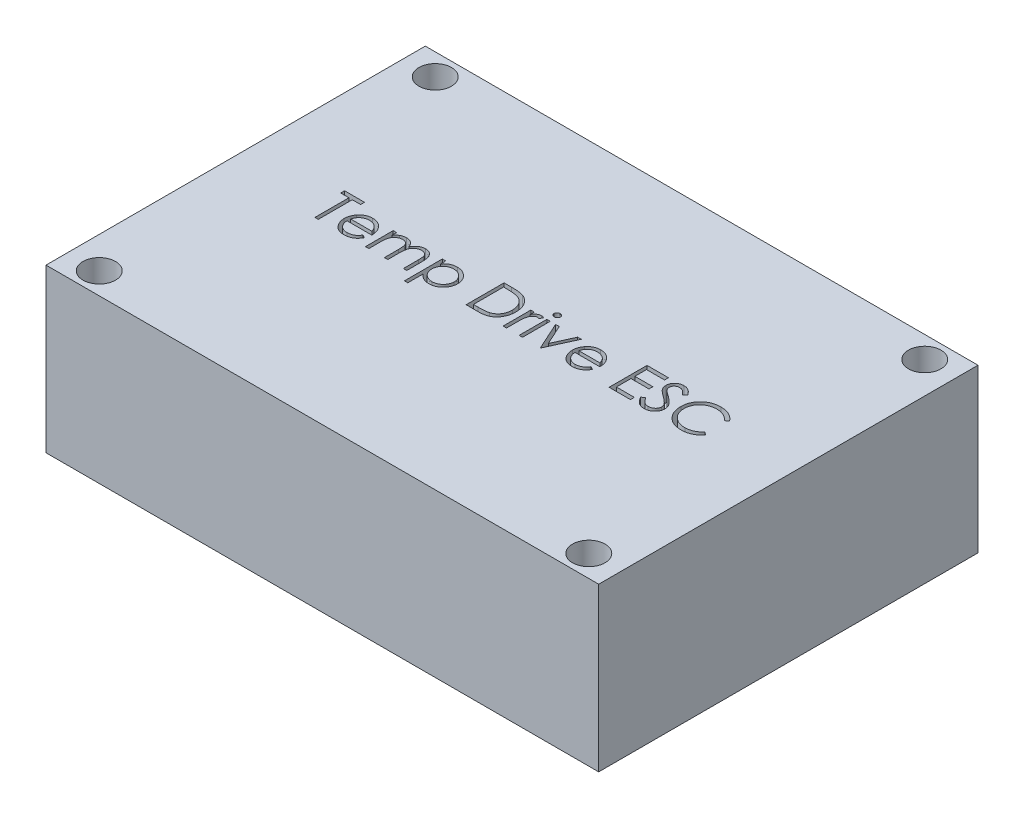
from build123d import *

# Parameters (mm, degrees)
SKETCH1_W           = 51
SKETCH1_H           = 35
SKETCH1_R           = 1.5
BOSS_EXTRUDE1_DEPTH = 15
SKETCH2_W           = 0.314102564
SKETCH2_H           = 2.557692308
CUT_EXTRUDE1_DEPTH  = 1.4


with BuildPart() as part:
    # Sketch1 → Boss-Extrude1 (new body)
    with BuildSketch(Plane(origin=(0, 0, 0), x_dir=(1, 0, 0), z_dir=(0, 1, 0))):
        Rectangle(SKETCH1_W, SKETCH1_H)
        with Locations((-22.585714286, 15.5)):
            Circle(SKETCH1_R, mode=Mode.SUBTRACT)
        with Locations((22.585714286, 15.5)):
            Circle(SKETCH1_R, mode=Mode.SUBTRACT)
        with Locations((22.585714286, -15.5)):
            Circle(SKETCH1_R, mode=Mode.SUBTRACT)
        with Locations((-22.585714286, -15.5)):
            Circle(SKETCH1_R, mode=Mode.SUBTRACT)
    extrude(amount=BOSS_EXTRUDE1_DEPTH)

    # Sketch2 → Cut-Extrude1 (cut)
    # profile 1 of 13: a face of its own
    with BuildSketch(Plane(origin=(0, 15, 0), x_dir=(1, 0, 0), z_dir=(0, 1, 0))):
        Polygon((-17.667113502, 1.856715019), (-17.667113502, 2.215689378), (-15.827369912, 2.215689378), (-15.827369912, 1.856715019), (-16.590190425, 1.856715019), (-16.590190425, -1.284310622), (-16.904292989, -1.284310622), (-16.904292989, 1.856715019), align=None)
    # profile 2 of 13: a face of its own
    with BuildSketch(Plane(origin=(0, 15, 0), x_dir=(1, 0, 0), z_dir=(0, 1, 0))):
        with BuildLine():
            Line((-13.279493309, -0.476618314), (-13.000446835, -0.62315277))
            add(Edge.make_bspline(
                [(-13.000446835, -0.62315277), (-13.02268343, -0.662596101), (-13.065947039, -0.739337204), (-13.140347787, -0.844769064), (-13.218339859, -0.93961678), (-13.303443827, -1.021346434), (-13.393113506, -1.092597819), (-13.487846161, -1.154935644), (-13.588134979, -1.208054164), (-13.693984703, -1.252806692), (-13.806284255, -1.287216186), (-13.925305771, -1.311520407), (-14.051277266, -1.326543676), (-14.137623446, -1.328288817), (-14.181837059, -1.329182417)],
                knots=[0, 0, 0, 0, 1.120438281, 2.179929193, 3.190490725, 4.156257408, 5.095198341, 6.022838206, 6.959905092, 7.901321166, 8.864066838, 9.862729781, 10.905609505, 12, 12, 12, 12], degree=3))
            add(Edge.make_bspline(
                [(-14.181837059, -1.329182417), (-14.230979037, -1.328035242), (-14.326840799, -1.325797435), (-14.466380546, -1.306504971), (-14.597759964, -1.275032612), (-14.720971667, -1.23106707), (-14.83571392, -1.173639746), (-14.942214775, -1.103680264), (-15.041034301, -1.02154801), (-15.12905851, -0.926531566), (-15.208302393, -0.824849609), (-15.278228213, -0.718893724), (-15.336685644, -0.6089305), (-15.384238254, -0.495659976), (-15.422643119, -0.379796082), (-15.449409823, -0.260284615), (-15.464839571, -0.137449031), (-15.467204016, -0.054351695), (-15.468395553, -0.012475686)],
                knots=[0, 0, 0, 0, 1.145258523, 2.234067595, 3.276747158, 4.290159414, 5.277019952, 6.260822364, 7.254936242, 8.264827045, 9.274100331, 10.257902744, 11.220704747, 12.172965371, 13.118907548, 14.062713208, 15.023725156, 16, 16, 16, 16], degree=3))
            add(Edge.make_bspline(
                [(-15.468395553, -0.012475686), (-15.467336412, 0.026819144), (-15.465237333, 0.104696309), (-15.452006546, 0.219961853), (-15.428558253, 0.331990306), (-15.396381929, 0.440874754), (-15.354830683, 0.546432888), (-15.303998464, 0.648728951), (-15.243806086, 0.747654091), (-15.197333412, 0.810057225), (-15.173924399, 0.84149066)],
                knots=[0, 0, 0, 0, 1.024358464, 2.0301432, 3.019427413, 4.004406732, 4.986367066, 5.972626655, 6.978780325, 8, 8, 8, 8], degree=3))
            add(Edge.make_bspline(
                [(-15.173924399, 0.84149066), (-15.142216716, 0.87935953), (-15.07980577, 0.95389768), (-14.974249414, 1.051836006), (-14.859949218, 1.133879781), (-14.738337592, 1.201886918), (-14.608001118, 1.253560565), (-14.470691827, 1.292068147), (-14.324846241, 1.313646158), (-14.22514102, 1.316693991), (-14.17412472, 1.31825348)],
                knots=[0, 0, 0, 0, 1.030682036, 2.02871468, 2.997146059, 3.962720338, 4.930598197, 5.918074684, 6.934738563, 8, 8, 8, 8], degree=3))
            add(Edge.make_bspline(
                [(-14.17412472, 1.31825348), (-14.121677114, 1.316899432), (-14.018786868, 1.314243096), (-13.868754747, 1.289616763), (-13.726794031, 1.250564208), (-13.592961527, 1.195410418), (-13.467243666, 1.124250866), (-13.350457616, 1.036109025), (-13.240606104, 0.933690937), (-13.176697525, 0.854927728), (-13.144176803, 0.814848032)],
                knots=[0, 0, 0, 0, 1.056321875, 2.072262726, 3.055038591, 4.01806755, 4.982017516, 5.957941055, 6.960871419, 8, 8, 8, 8], degree=3))
            add(Edge.make_bspline(
                [(-13.144176803, 0.814848032), (-13.122049865, 0.78464445), (-13.077943272, 0.724438332), (-13.022696172, 0.626267175), (-12.974738777, 0.52355658), (-12.936405816, 0.414646283), (-12.905366314, 0.300826703), (-12.882909496, 0.181284158), (-12.869739877, 0.056054247), (-12.86715118, -0.029272309), (-12.86583145, -0.072772161)],
                knots=[0, 0, 0, 0, 0.94817472, 1.890038105, 2.849395472, 3.817997239, 4.812318967, 5.836947057, 6.897266129, 8, 8, 8, 8], degree=3))
            Line((-12.86583145, -0.072772161), (-15.154292989, -0.072772161))
            add(Edge.make_bspline(
                [(-15.154292989, -0.072772161), (-15.152753382, -0.106472625), (-15.149725808, -0.172743229), (-15.135610665, -0.269714012), (-15.113361892, -0.362087354), (-15.082092829, -0.449170396), (-15.044225984, -0.532100523), (-14.997840267, -0.61026256), (-14.942500713, -0.68330049), (-14.880775014, -0.751867628), (-14.812067918, -0.812928389), (-14.739785171, -0.867580165), (-14.662891606, -0.913385762), (-14.581993522, -0.950565652), (-14.497221737, -0.979671968), (-14.408549542, -0.999539789), (-14.316151426, -1.012846895), (-14.253165692, -1.014326561), (-14.22109988, -1.015079853)],
                knots=[0, 0, 0, 0, 1.094153842, 2.151609401, 3.174256925, 4.172055639, 5.149267565, 6.128595816, 7.11444997, 8.118368179, 9.117203808, 10.09244225, 11.054858984, 12.015122123, 12.976791628, 13.957293641, 14.960065497, 16, 16, 16, 16], degree=3))
            add(Edge.make_bspline(
                [(-14.22109988, -1.015079853), (-14.189748732, -1.014471796), (-14.127542041, -1.013265295), (-14.034901184, -1.001533384), (-13.943761657, -0.982563109), (-13.854500673, -0.956673119), (-13.768929827, -0.925096266), (-13.689684277, -0.886993409), (-13.616804062, -0.844843662), (-13.548687095, -0.796633987), (-13.482616102, -0.7376258), (-13.417073615, -0.663990079), (-13.346796962, -0.576902551), (-13.302807369, -0.511356885), (-13.279493309, -0.476618314)],
                knots=[0, 0, 0, 0, 0.99110716, 1.966546729, 2.947904876, 3.932708344, 4.903319531, 5.828989031, 6.710028674, 7.56322171, 8.463672341, 9.504779593, 10.677557249, 12, 12, 12, 12], degree=3))
        make_face()
        with BuildLine():
            add(Edge.make_bspline(
                [(-13.179934015, 0.241330403), (-13.191430639, 0.282993277), (-13.213557941, 0.363180898), (-13.259794305, 0.474221788), (-13.311865846, 0.572909689), (-13.373487577, 0.658489322), (-13.443306303, 0.734492835), (-13.523951485, 0.80091142), (-13.614387379, 0.860328872), (-13.71414652, 0.910481371), (-13.819788305, 0.95317123), (-13.930394497, 0.981796345), (-14.043252284, 1.001405888), (-14.119586571, 1.003231996), (-14.157998918, 1.004150916)],
                knots=[0, 0, 0, 0, 1.154881502, 2.222775134, 3.210006277, 4.132804581, 5.035138423, 5.962687519, 6.919655026, 7.923214229, 8.944639381, 9.960483929, 10.97369054, 12, 12, 12, 12], degree=3))
            add(Edge.make_bspline(
                [(-14.157998918, 1.004150916), (-14.189348357, 1.003539245), (-14.251319606, 1.002330099), (-14.342620674, 0.990859969), (-14.430300373, 0.971900125), (-14.515005661, 0.945935168), (-14.595626529, 0.911326565), (-14.673821297, 0.870743339), (-14.747601693, 0.821201755), (-14.793742989, 0.7834429), (-14.817053406, 0.764367262)],
                knots=[0, 0, 0, 0, 1.04873581, 2.073130211, 3.073294108, 4.04793562, 5.032784715, 6.005352987, 6.992311501, 8, 8, 8, 8], degree=3))
            add(Edge.make_bspline(
                [(-14.817053406, 0.764367262), (-14.833746687, 0.749272947), (-14.867529822, 0.718725731), (-14.912670343, 0.666096524), (-14.955890816, 0.609344962), (-14.995224469, 0.546299837), (-15.031302055, 0.477679058), (-15.065062032, 0.404061423), (-15.095448444, 0.324888293), (-15.112544554, 0.269715854), (-15.121340265, 0.241330403)],
                knots=[0, 0, 0, 0, 0.879870761, 1.780643979, 2.707998968, 3.669668524, 4.684282772, 5.740141944, 6.837334558, 8, 8, 8, 8], degree=3))
            Line((-15.121340265, 0.241330403), (-13.179934015, 0.241330403))
        make_face(mode=Mode.SUBTRACT)
    # profile 3 of 13: a face of its own
    with BuildSketch(Plane(origin=(0, 15, 0), x_dir=(1, 0, 0), z_dir=(0, 1, 0))):
        with BuildLine():
            Line((-12.237626322, 1.273381686), (-11.923523758, 1.273381686))
            Line((-11.923523758, 1.273381686), (-11.923523758, 0.828870468))
            add(Edge.make_bspline(
                [(-11.923523758, 0.828870468), (-11.895239808, 0.867758069), (-11.841045049, 0.942270442), (-11.752179396, 1.040460727), (-11.663403284, 1.123788881), (-11.599469902, 1.167531753), (-11.56875613, 1.188545948)],
                knots=[0, 0, 0, 0, 1.134379233, 2.173579362, 3.122582517, 4, 4, 4, 4], degree=3))
            add(Edge.make_bspline(
                [(-11.56875613, 1.188545948), (-11.526891468, 1.208551314), (-11.443893568, 1.248212527), (-11.312474343, 1.288446086), (-11.177999674, 1.313171187), (-11.08719146, 1.316552561), (-11.04151254, 1.31825348)],
                knots=[0, 0, 0, 0, 1.014936303, 2.012140481, 3.000054389, 4, 4, 4, 4], degree=3))
            add(Edge.make_bspline(
                [(-11.04151254, 1.31825348), (-11.010619544, 1.31720819), (-10.949483965, 1.315139615), (-10.858899874, 1.30167958), (-10.771041263, 1.278413407), (-10.686427233, 1.246006083), (-10.606706554, 1.206759396), (-10.533617356, 1.160709688), (-10.467993148, 1.109012613), (-10.409867097, 1.04933368), (-10.357598071, 0.979997081), (-10.309519225, 0.899132833), (-10.265094012, 0.804925172), (-10.240472704, 0.736558631), (-10.227510136, 0.700565179)],
                knots=[0, 0, 0, 0, 1.009824226, 1.998387844, 2.986035974, 3.974953746, 4.955485308, 5.885931332, 6.793869504, 7.679848016, 8.601185859, 9.625726857, 10.749998409, 12, 12, 12, 12], degree=3))
            add(Edge.make_bspline(
                [(-10.227510136, 0.700565179), (-10.213798885, 0.725289598), (-10.186817068, 0.773943783), (-10.141511431, 0.842802046), (-10.094043634, 0.907208837), (-10.044009141, 0.967215262), (-9.991584554, 1.022524992), (-9.936523154, 1.073320894), (-9.879138373, 1.119821108), (-9.799346133, 1.174144267), (-9.695533525, 1.231845448), (-9.564645411, 1.281873892), (-9.428495239, 1.312790021), (-9.336077541, 1.316420294), (-9.289409175, 1.31825348)],
                knots=[0, 0, 0, 0, 0.86119277, 1.694706429, 2.50939023, 3.298075842, 4.073795165, 4.829715201, 5.57930267, 6.321991688, 7.768977793, 9.186738141, 10.579381044, 12, 12, 12, 12], degree=3))
            add(Edge.make_bspline(
                [(-9.289409175, 1.31825348), (-9.246527712, 1.31663626), (-9.162604526, 1.313471201), (-9.04042726, 1.288617728), (-8.926485455, 1.245940081), (-8.821008379, 1.187706444), (-8.725848565, 1.114527261), (-8.643132256, 1.027458423), (-8.573361893, 0.9271158), (-8.527783253, 0.832723812), (-8.496867989, 0.749388479), (-8.477806754, 0.678382188), (-8.460967059, 0.600230635), (-8.446985814, 0.514840373), (-8.436767262, 0.421909765), (-8.429196546, 0.321590889), (-8.424072473, 0.213805777), (-8.423710401, 0.139440277), (-8.423523758, 0.101106045)],
                knots=[0, 0, 0, 0, 1.209669288, 2.367440248, 3.500751976, 4.631527125, 5.755587489, 6.87532382, 8.007944318, 9.190864318, 9.82315674, 10.514484317, 11.263564316, 12.079023757, 12.955305781, 13.901327259, 14.918167583, 16, 16, 16, 16], degree=3))
            Line((-8.423523758, 0.101106045), (-8.423523758, -1.284310622))
            Line((-8.423523758, -1.284310622), (-8.737626322, -1.284310622))
            Line((-8.737626322, -1.284310622), (-8.737626322, 0.102508288))
            add(Edge.make_bspline(
                [(-8.737626322, 0.102508288), (-8.737704205, 0.135228862), (-8.737853884, 0.198112829), (-8.740547516, 0.28836528), (-8.74562283, 0.370633637), (-8.751557469, 0.444805725), (-8.759801278, 0.511054514), (-8.77044721, 0.569246933), (-8.78172489, 0.619840744), (-8.800460881, 0.675926792), (-8.830408773, 0.737797002), (-8.876026253, 0.804520578), (-8.933496359, 0.862601378), (-8.999856515, 0.913019695), (-9.07540496, 0.954013336), (-9.158669683, 0.983289346), (-9.249133735, 1.001412224), (-9.311756523, 1.00321824), (-9.344096675, 1.004150916)],
                knots=[0, 0, 0, 0, 1.253487763, 2.409012846, 3.458416907, 4.410876679, 5.259312806, 6.014470957, 6.676830364, 7.243083969, 8.276244668, 9.299465089, 10.325150304, 11.392391894, 12.482080715, 13.603491619, 14.762376348, 16, 16, 16, 16], degree=3))
            add(Edge.make_bspline(
                [(-9.344096675, 1.004150916), (-9.383766629, 1.002734759), (-9.46216954, 0.999935894), (-9.576615027, 0.971362021), (-9.686586043, 0.92828177), (-9.788801176, 0.865849313), (-9.882828967, 0.791040949), (-9.963728544, 0.702091353), (-10.03056073, 0.601461426), (-10.075814706, 0.508314724), (-10.104404007, 0.42464528), (-10.123280923, 0.351547908), (-10.137964315, 0.26846634), (-10.151734844, 0.175958849), (-10.160722572, 0.073388669), (-10.168890944, -0.038769732), (-10.172711807, -0.160853691), (-10.173246266, -0.24548038), (-10.173523758, -0.289418795)],
                knots=[0, 0, 0, 0, 1.090531906, 2.155305635, 3.229839962, 4.33261226, 5.44038871, 6.529323825, 7.629011124, 8.757537029, 9.370236727, 10.061839251, 10.834451254, 11.692844982, 12.636905849, 13.66920014, 14.789842145, 16, 16, 16, 16], degree=3))
            Line((-10.173523758, -0.289418795), (-10.173523758, -1.284310622))
            Line((-10.173523758, -1.284310622), (-10.487626322, -1.284310622))
            Line((-10.487626322, -1.284310622), (-10.487626322, 0.016270307))
            add(Edge.make_bspline(
                [(-10.487626322, 0.016270307), (-10.487705753, 0.052963626), (-10.48785857, 0.123557883), (-10.490534888, 0.224791559), (-10.495621509, 0.316872639), (-10.501502058, 0.399694103), (-10.509962236, 0.473105431), (-10.519571998, 0.537500189), (-10.530920609, 0.59271694), (-10.549710494, 0.653280325), (-10.578424962, 0.720001248), (-10.624613224, 0.791142269), (-10.682220804, 0.853410367), (-10.74979168, 0.906569115), (-10.825797362, 0.950510597), (-10.909780763, 0.982170348), (-11.000985676, 1.000594638), (-11.063863382, 1.002943135), (-11.09620004, 1.004150916)],
                knots=[0, 0, 0, 0, 1.320475261, 2.540461679, 3.643808994, 4.639130445, 5.527981419, 6.302341397, 6.981980563, 7.553956391, 8.582137848, 9.585246428, 10.591171744, 11.620968678, 12.668337649, 13.738356861, 14.836885341, 16, 16, 16, 16], degree=3))
            add(Edge.make_bspline(
                [(-11.09620004, 1.004150916), (-11.134216252, 1.002620456), (-11.209981211, 0.999570304), (-11.321283181, 0.97211603), (-11.428768864, 0.929111955), (-11.530723563, 0.869452136), (-11.624397711, 0.795553058), (-11.706405979, 0.708638162), (-11.775348504, 0.609789128), (-11.821080319, 0.517624612), (-11.850578793, 0.436051337), (-11.870174128, 0.366700389), (-11.887013754, 0.289700141), (-11.899527775, 0.20481303), (-11.911608191, 0.112591936), (-11.9174385, 0.012577446), (-11.923110062, -0.095144642), (-11.923382477, -0.169517187), (-11.923523758, -0.208088667)],
                knots=[0, 0, 0, 0, 1.098833095, 2.189935336, 3.297829714, 4.440610912, 5.596351641, 6.740013378, 7.886572111, 9.072425424, 9.705826452, 10.395263256, 11.156850408, 11.985370555, 12.878090359, 13.847760091, 14.883794034, 16, 16, 16, 16], degree=3))
            Line((-11.923523758, -0.208088667), (-11.923523758, -1.284310622))
            Line((-11.923523758, -1.284310622), (-12.237626322, -1.284310622))
            Line((-12.237626322, -1.284310622), (-12.237626322, 1.273381686))
        make_face()
    # profile 4 of 13: a face of its own
    with BuildSketch(Plane(origin=(0, 15, 0), x_dir=(1, 0, 0), z_dir=(0, 1, 0))):
        with BuildLine():
            Line((-7.70557504, 1.273381686), (-7.391472476, 1.273381686))
            Line((-7.391472476, 1.273381686), (-7.391472476, 0.800124474))
            add(Edge.make_bspline(
                [(-7.391472476, 0.800124474), (-7.358114992, 0.843062208), (-7.293291397, 0.926503101), (-7.181566492, 1.034493229), (-7.063639684, 1.125568533), (-6.936476271, 1.196951066), (-6.802052581, 1.250771878), (-6.660920264, 1.290551328), (-6.511881499, 1.313992802), (-6.409985046, 1.316814464), (-6.35801895, 1.31825348)],
                knots=[0, 0, 0, 0, 1.0828784, 2.104357462, 3.088488658, 4.04616522, 5.001424249, 5.969181776, 6.964304535, 8, 8, 8, 8], degree=3))
            add(Edge.make_bspline(
                [(-6.35801895, 1.31825348), (-6.312627347, 1.316940302), (-6.222908459, 1.314344734), (-6.09084523, 1.29677168), (-5.963669846, 1.266653987), (-5.842101792, 1.223253072), (-5.724838727, 1.169597602), (-5.613616627, 1.101880567), (-5.506703072, 1.023474376), (-5.406786883, 0.933242225), (-5.314465515, 0.835613959), (-5.234619334, 0.730591654), (-5.16574743, 0.621629068), (-5.110077133, 0.507036976), (-5.066468786, 0.387717746), (-5.035454108, 0.263189305), (-5.016996465, 0.133913365), (-5.014520013, 0.046010644), (-5.013267348, 0.00154675)],
                knots=[0, 0, 0, 0, 1.041296284, 2.058176809, 3.050446431, 4.034000596, 5.01514041, 6.003636468, 7.015969324, 8.052561599, 9.08815499, 10.094063707, 11.074456064, 12.040834395, 13.011057502, 13.983766392, 14.980127149, 16, 16, 16, 16], degree=3))
            add(Edge.make_bspline(
                [(-5.013267348, 0.00154675), (-5.014492833, -0.043855559), (-5.016909668, -0.133395463), (-5.035654674, -0.264882561), (-5.065611548, -0.391369934), (-5.108669731, -0.512647198), (-5.164311219, -0.628630849), (-5.23201578, -0.739237245), (-5.311902247, -0.844430949), (-5.403203375, -0.942783849), (-5.502256311, -1.033383162), (-5.6081338, -1.112621231), (-5.719192726, -1.179162606), (-5.834864893, -1.234745566), (-5.956140531, -1.27663775), (-6.082453809, -1.306855551), (-6.213735955, -1.325490046), (-6.303037107, -1.327942189), (-6.348203245, -1.329182417)],
                knots=[0, 0, 0, 0, 1.038740735, 2.04854663, 3.033179607, 4.009277356, 4.987731542, 5.972001279, 6.972200261, 8.005528982, 9.039189865, 10.040446548, 11.026516639, 11.997840187, 12.972163198, 13.956796175, 14.96660207, 16, 16, 16, 16], degree=3))
            add(Edge.make_bspline(
                [(-6.348203245, -1.329182417), (-6.399030817, -1.327887609), (-6.499430173, -1.325329984), (-6.646227844, -1.299410574), (-6.787504696, -1.260673639), (-6.92169552, -1.203974645), (-7.049863333, -1.131719129), (-7.171283139, -1.043608923), (-7.286599892, -0.939828299), (-7.356008649, -0.861096482), (-7.391472476, -0.820869116)],
                knots=[0, 0, 0, 0, 1.014726462, 2.004382257, 2.969841629, 3.936926163, 4.907207904, 5.903978561, 6.929055279, 8, 8, 8, 8], degree=3))
            Line((-7.391472476, -0.820869116), (-7.391472476, -2.226618314))
            Line((-7.391472476, -2.226618314), (-7.70557504, -2.226618314))
            Line((-7.70557504, -2.226618314), (-7.70557504, 1.273381686))
        make_face()
        with BuildLine():
            add(Edge.make_bspline(
                [(-6.360823438, 1.004150916), (-6.396403, 1.003510658), (-6.466449988, 1.002250155), (-6.569122207, 0.987276206), (-6.668017635, 0.965538465), (-6.762139586, 0.932626564), (-6.852390202, 0.892227751), (-6.938074367, 0.84174574), (-7.019131935, 0.782093734), (-7.095358965, 0.71441439), (-7.164222259, 0.639839702), (-7.225185187, 0.560251893), (-7.276392492, 0.475751753), (-7.318894512, 0.387126391), (-7.351237795, 0.293681106), (-7.374193514, 0.195948093), (-7.388623867, 0.093820381), (-7.390512805, 0.024264374), (-7.391472476, -0.011073443)],
                knots=[0, 0, 0, 0, 1.05670511, 2.080379991, 3.077984906, 4.06214886, 5.038337365, 6.01289324, 7.01187578, 8.025460281, 9.038092164, 10.024533457, 11.000252242, 11.969694649, 12.940728589, 13.933144304, 14.949937299, 16, 16, 16, 16], degree=3))
            add(Edge.make_bspline(
                [(-7.391472476, -0.011073443), (-7.38988162, -0.057461555), (-7.386764998, -0.148339796), (-7.36142763, -0.281123918), (-7.320192366, -0.406775574), (-7.261663652, -0.524236611), (-7.187716078, -0.632219446), (-7.098617922, -0.728910052), (-6.995175371, -0.813700643), (-6.879108179, -0.885121897), (-6.754686048, -0.943109964), (-6.624900136, -0.984624174), (-6.491535255, -1.010196402), (-6.401366936, -1.013443221), (-6.355915585, -1.015079853)],
                knots=[0, 0, 0, 0, 1.03728447, 2.032128127, 3.01272805, 3.987917167, 4.958271349, 5.931593992, 6.91984656, 7.941419022, 8.973179163, 9.983609215, 10.983593296, 12, 12, 12, 12], degree=3))
            add(Edge.make_bspline(
                [(-6.355915585, -1.015079853), (-6.311379817, -1.013523476), (-6.222984324, -1.010434348), (-6.092826203, -0.98369616), (-5.966335564, -0.942851136), (-5.846155392, -0.883291579), (-5.733331904, -0.810301521), (-5.63145035, -0.722741488), (-5.542443437, -0.621251545), (-5.466579082, -0.508243042), (-5.405447596, -0.387067658), (-5.359517357, -0.26168627), (-5.333008783, -0.132540847), (-5.329251995, -0.045543134), (-5.327369912, -0.001958859)],
                knots=[0, 0, 0, 0, 1.00104056, 1.986885549, 2.97790532, 3.984399681, 4.995088187, 5.994304198, 6.996462723, 8.023150851, 9.048424203, 10.043036403, 11.019596776, 12, 12, 12, 12], degree=3))
            add(Edge.make_bspline(
                [(-5.327369912, -0.001958859), (-5.328824646, 0.04189613), (-5.33172278, 0.129264433), (-5.360269817, 0.258027336), (-5.403169795, 0.383915313), (-5.465728847, 0.503435862), (-5.539930116, 0.616209945), (-5.629677113, 0.715763824), (-5.73029331, 0.802934497), (-5.842982474, 0.874949907), (-5.963922899, 0.932235401), (-6.091237815, 0.97411904), (-6.224281418, 0.99929279), (-6.314909072, 1.002517296), (-6.360823438, 1.004150916)],
                knots=[0, 0, 0, 0, 0.983928682, 1.960191568, 2.949917689, 3.96440592, 4.982380491, 5.975291189, 6.965713506, 7.964880129, 8.970154049, 9.96478489, 10.968906225, 12, 12, 12, 12], degree=3))
        make_face(mode=Mode.SUBTRACT)
    # profile 5 of 13: a face of its own
    with BuildSketch(Plane(origin=(0, 15, 0), x_dir=(1, 0, 0), z_dir=(0, 1, 0))):
        with BuildLine():
            Line((-2.949164784, -1.284310622), (-2.949164784, 2.215689378))
            Line((-2.949164784, 2.215689378), (-2.242434015, 2.215689378))
            add(Edge.make_bspline(
                [(-2.242434015, 2.215689378), (-2.180965026, 2.215246808), (-2.062207261, 2.214391765), (-1.890594814, 2.208970374), (-1.731811051, 2.199379908), (-1.586378192, 2.185410382), (-1.45389698, 2.168257348), (-1.334738372, 2.146756944), (-1.228286229, 2.121368773), (-1.162816788, 2.099723323), (-1.131857091, 2.089487455)],
                knots=[0, 0, 0, 0, 1.314313732, 2.53924729, 3.670748893, 4.714932338, 5.66265055, 6.526160246, 7.303039223, 8, 8, 8, 8], degree=3))
            add(Edge.make_bspline(
                [(-1.131857091, 2.089487455), (-1.091362352, 2.074056749), (-1.01129116, 2.043545255), (-0.897284037, 1.985988954), (-0.789958674, 1.920775852), (-0.688739529, 1.847819989), (-0.595938703, 1.765055641), (-0.507930806, 1.675998555), (-0.428316082, 1.577410215), (-0.355407786, 1.471335227), (-0.289672127, 1.359023175), (-0.232532969, 1.240688066), (-0.185078976, 1.116930858), (-0.145685749, 0.98809571), (-0.114639292, 0.853899332), (-0.09345736, 0.714185466), (-0.07948637, 0.569506277), (-0.078082319, 0.471331813), (-0.077369912, 0.421518705)],
                knots=[0, 0, 0, 0, 0.984719456, 1.947108742, 2.898477687, 3.838006223, 4.779231079, 5.722358779, 6.681677486, 7.655904652, 8.64651281, 9.637519902, 10.640069247, 11.656948941, 12.698408672, 13.768548281, 14.867775369, 16, 16, 16, 16], degree=3))
            add(Edge.make_bspline(
                [(-0.077369912, 0.421518705), (-0.077998879, 0.378257466), (-0.079238326, 0.293006677), (-0.090367641, 0.167365782), (-0.106543961, 0.04545221), (-0.131588159, -0.07215349), (-0.161990673, -0.186481708), (-0.200954824, -0.296313952), (-0.24559032, -0.402657761), (-0.297640199, -0.504075237), (-0.354781584, -0.600158609), (-0.416103327, -0.690734138), (-0.481540022, -0.774509359), (-0.551715655, -0.851737971), (-0.625723372, -0.92230355), (-0.704047702, -0.986795565), (-0.786890753, -1.04395212), (-0.873881476, -1.096019228), (-0.967557605, -1.141439584), (-1.069693471, -1.179869594), (-1.180724649, -1.211716209), (-1.300378606, -1.238287105), (-1.428862084, -1.259364407), (-1.56630105, -1.2734908), (-1.712484339, -1.283043733), (-1.812863605, -1.283880126), (-1.864529367, -1.284310622)],
                knots=[0, 0, 0, 0, 1.105936401, 2.179363191, 3.223086493, 4.248585256, 5.251745608, 6.245858792, 7.225916811, 8.198733463, 9.158002045, 10.082870192, 10.993790845, 11.873723703, 12.748670949, 13.606408763, 14.465103618, 15.319838547, 16.196477973, 17.123216899, 18.106603292, 19.147568657, 20.255746949, 21.433717677, 22.679120308, 24, 24, 24, 24], degree=3))
            Line((-1.864529367, -1.284310622), (-2.949164784, -1.284310622))
        make_face()
        with BuildLine():
            Line((-2.63506222, -0.925336263), (-2.233319431, -0.925336263))
            add(Edge.make_bspline(
                [(-2.233319431, -0.925336263), (-2.17559106, -0.925088167), (-2.064558262, -0.924610987), (-1.904900265, -0.920423783), (-1.759020868, -0.913581846), (-1.626899359, -0.904006768), (-1.508610335, -0.891338153), (-1.403906585, -0.87721325), (-1.313131326, -0.859615799), (-1.258201889, -0.84366484), (-1.23281863, -0.836293795)],
                knots=[0, 0, 0, 0, 1.375205317, 2.645023457, 3.804390687, 4.853969522, 5.800190428, 6.637939096, 7.370582563, 8, 8, 8, 8], degree=3))
            add(Edge.make_bspline(
                [(-1.23281863, -0.836293795), (-1.200870268, -0.825042237), (-1.13773663, -0.802807864), (-1.046855544, -0.762250203), (-0.96209854, -0.714208133), (-0.881988514, -0.660805859), (-0.807661859, -0.600159857), (-0.738237743, -0.533588868), (-0.673855941, -0.460754093), (-0.615181633, -0.381745931), (-0.562673329, -0.297056136), (-0.5172021, -0.207517302), (-0.477350568, -0.114110492), (-0.446071976, -0.015401333), (-0.421556392, 0.087727725), (-0.404191704, 0.195283939), (-0.393376979, 0.30724722), (-0.392115531, 0.383399345), (-0.391472476, 0.422219827)],
                knots=[0, 0, 0, 0, 0.998632004, 1.973411704, 2.929992603, 3.868527914, 4.809262121, 5.754881198, 6.702106254, 7.672490631, 8.653608572, 9.636854334, 10.631411391, 11.644891563, 12.686317036, 13.754757253, 14.855430412, 16, 16, 16, 16], degree=3))
            add(Edge.make_bspline(
                [(-0.391472476, 0.422219827), (-0.391985763, 0.463153307), (-0.392994121, 0.543567491), (-0.405668431, 0.661558187), (-0.424189987, 0.775038837), (-0.450973673, 0.884017032), (-0.485104552, 0.988705385), (-0.527699194, 1.088524895), (-0.576365813, 1.184529764), (-0.63426915, 1.274504129), (-0.697684743, 1.359597239), (-0.768062622, 1.437552154), (-0.844284661, 1.508546454), (-0.92551951, 1.573685767), (-1.01405661, 1.630349443), (-1.1078103, 1.681036124), (-1.208155972, 1.724052015), (-1.277968667, 1.746930878), (-1.313447636, 1.758557968)],
                knots=[0, 0, 0, 0, 1.122418816, 2.205001699, 3.251619955, 4.274784885, 5.280384055, 6.268708349, 7.249350384, 8.229342522, 9.199999885, 10.157847722, 11.105861043, 12.055065948, 13.010012805, 13.98527497, 14.976112212, 16, 16, 16, 16], degree=3))
            add(Edge.make_bspline(
                [(-1.313447636, 1.758557968), (-1.342798783, 1.766674395), (-1.405207373, 1.783932148), (-1.507046837, 1.802757521), (-1.621661986, 1.81936202), (-1.749561688, 1.833420059), (-1.890600147, 1.84350738), (-2.044885835, 1.851078695), (-2.212485439, 1.856185327), (-2.328667973, 1.856534035), (-2.38896847, 1.856715019)],
                knots=[0, 0, 0, 0, 0.674548936, 1.434276114, 2.292660221, 3.240891867, 4.284742987, 5.42552168, 6.663806718, 8, 8, 8, 8], degree=3))
            Line((-2.38896847, 1.856715019), (-2.63506222, 1.856715019))
            Line((-2.63506222, 1.856715019), (-2.63506222, -0.925336263))
        make_face(mode=Mode.SUBTRACT)
    # profile 6 of 13: a face of its own
    with BuildSketch(Plane(origin=(0, 15, 0), x_dir=(1, 0, 0), z_dir=(0, 1, 0))):
        with BuildLine():
            Line((0.461091627, 1.273381686), (0.775194191, 1.273381686))
            Line((0.775194191, 1.273381686), (0.775194191, 0.896879282))
            add(Edge.make_bspline(
                [(0.775194191, 0.896879282), (0.798382949, 0.93193511), (0.84273127, 0.998979109), (0.9164442, 1.08764841), (0.991947531, 1.161063457), (1.069602718, 1.219566976), (1.149980818, 1.263380095), (1.23131777, 1.29547313), (1.31489324, 1.314450445), (1.371055164, 1.316984104), (1.399192588, 1.31825348)],
                knots=[0, 0, 0, 0, 1.2804753, 2.448899062, 3.506932113, 4.484331642, 5.4025378, 6.288909075, 7.142734305, 8, 8, 8, 8], degree=3))
            add(Edge.make_bspline(
                [(1.399192588, 1.31825348), (1.421018915, 1.317062954), (1.465928, 1.314613368), (1.53391059, 1.297402543), (1.603954041, 1.269924521), (1.649096429, 1.244084298), (1.672630088, 1.230613256)],
                knots=[0, 0, 0, 0, 0.901110191, 1.854092781, 2.881294221, 4, 4, 4, 4], degree=3))
            Line((1.672630088, 1.230613256), (1.500154127, 0.958578))
            add(Edge.make_bspline(
                [(1.500154127, 0.958578), (1.485045105, 0.965318266), (1.456365291, 0.978112581), (1.414410725, 0.993254591), (1.375729388, 1.002170507), (1.351085829, 1.003521225), (1.339597235, 1.004150916)],
                knots=[0, 0, 0, 0, 1.180555205, 2.24091978, 3.179933427, 4, 4, 4, 4], degree=3))
            add(Edge.make_bspline(
                [(1.339597235, 1.004150916), (1.314391502, 1.002470879), (1.262979112, 0.99904409), (1.187494613, 0.972105282), (1.114247407, 0.928580042), (1.056075745, 0.88030893), (1.011033492, 0.833761133), (0.978893266, 0.79311273), (0.949410519, 0.747534098), (0.921240299, 0.697804415), (0.895574005, 0.643074569), (0.871619336, 0.583891355), (0.849960473, 0.520186226), (0.837610228, 0.475803706), (0.831283934, 0.453069186)],
                knots=[0, 0, 0, 0, 1.125678352, 2.296057538, 3.5422874, 4.923748041, 5.663163013, 6.437101912, 7.23742474, 8.08941207, 8.991984279, 9.93940061, 10.944477711, 12, 12, 12, 12], degree=3))
            add(Edge.make_bspline(
                [(0.831283934, 0.453069186), (0.826551541, 0.432792012), (0.816069649, 0.387879613), (0.805878111, 0.312531089), (0.795808593, 0.22350743), (0.788711975, 0.120560837), (0.782133933, 0.003948393), (0.778423851, -0.126507553), (0.77532071, -0.270940904), (0.775237643, -0.371915257), (0.775194191, -0.424735302)],
                knots=[0, 0, 0, 0, 0.566838948, 1.255505196, 2.06880316, 3.007127437, 4.065329342, 5.249902469, 6.561414163, 8, 8, 8, 8], degree=3))
            Line((0.775194191, -0.424735302), (0.775194191, -1.284310622))
            Line((0.775194191, -1.284310622), (0.461091627, -1.284310622))
            Line((0.461091627, -1.284310622), (0.461091627, 1.273381686))
        make_face()
    # profile 7 of 13: a face of its own
    with BuildSketch(Plane(origin=(0, 15, 0), x_dir=(1, 0, 0), z_dir=(0, 1, 0))):
        with BuildLine():
            add(Edge.make_bspline(
                [(2.097509896, 2.350304762), (2.117001212, 2.34940061), (2.155168951, 2.347630106), (2.210362219, 2.332468629), (2.260619231, 2.306768944), (2.305196964, 2.272289263), (2.343448851, 2.231739819), (2.370229561, 2.184478851), (2.387441957, 2.133420212), (2.389520512, 2.097805123), (2.390578806, 2.07967175)],
                knots=[0, 0, 0, 0, 1.055194115, 2.066272739, 3.074728998, 4.095836921, 5.109056067, 6.073838105, 7.019297344, 8, 8, 8, 8], degree=3))
            add(Edge.make_bspline(
                [(2.390578806, 2.07967175), (2.389496646, 2.062009096), (2.387357344, 2.027092121), (2.370242856, 1.976918649), (2.343220618, 1.930314366), (2.305221493, 1.889843656), (2.260612732, 1.855383036), (2.210363946, 1.829678297), (2.155168497, 1.814518159), (2.117001058, 1.812747471), (2.097509896, 1.811843224)],
                knots=[0, 0, 0, 0, 0.96129708, 1.900370562, 2.859976407, 3.87933698, 4.906634145, 5.921202961, 6.938410037, 8, 8, 8, 8], degree=3))
            add(Edge.make_bspline(
                [(2.097509896, 1.811843224), (2.078241621, 1.812712944), (2.04073844, 1.814405741), (1.986371598, 1.829975759), (1.936543109, 1.855391832), (1.891878436, 1.889618017), (1.854648243, 1.930562914), (1.827549917, 1.976890208), (1.810474956, 2.027099363), (1.808330327, 2.062011529), (1.807245473, 2.07967175)],
                knots=[0, 0, 0, 0, 1.054934014, 2.053291228, 3.073705704, 4.106921865, 5.123545215, 6.088680038, 7.033164197, 8, 8, 8, 8], degree=3))
            add(Edge.make_bspline(
                [(1.807245473, 2.07967175), (1.808306559, 2.097802599), (1.8103906, 2.133412732), (1.827562716, 2.184507765), (1.854422524, 2.231489267), (1.891903088, 2.272514766), (1.936536548, 2.306760201), (1.986373293, 2.332171182), (2.040737993, 2.347742522), (2.078241469, 2.349435136), (2.097509896, 2.350304762)],
                knots=[0, 0, 0, 0, 0.98631895, 1.937192651, 2.907499808, 3.917963147, 4.944918757, 5.95915025, 6.951458133, 8, 8, 8, 8], degree=3))
        make_face()
    # profile 8 of 13: a face of its own
    with BuildSketch(Plane(origin=(0, 15, 0), x_dir=(1, 0, 0), z_dir=(0, 1, 0))):
        with Locations((2.098912139, -0.005464468)):
            Rectangle(SKETCH2_W, SKETCH2_H)
    # profile 9 of 13: a face of its own
    with BuildSketch(Plane(origin=(0, 15, 0), x_dir=(1, 0, 0), z_dir=(0, 1, 0))):
        Polygon((2.749553165, 1.273381686), (3.089597235, 1.273381686), (3.938655729, -0.588797802), (4.787714223, 1.273381686), (5.127758293, 1.273381686), (3.961091627, -1.284310622), (3.916219832, -1.284310622), align=None)
    # profile 10 of 13: a face of its own
    with BuildSketch(Plane(origin=(0, 15, 0), x_dir=(1, 0, 0), z_dir=(0, 1, 0))):
        with BuildLine():
            Line((7.765378485, -0.476618314), (8.04442496, -0.62315277))
            add(Edge.make_bspline(
                [(8.04442496, -0.62315277), (8.022188365, -0.662596101), (7.978924756, -0.739337204), (7.904524008, -0.844769064), (7.826531936, -0.93961678), (7.741427968, -1.021346434), (7.651758289, -1.092597819), (7.557025634, -1.154935644), (7.456736816, -1.208054164), (7.350887091, -1.252806692), (7.23858754, -1.287216186), (7.119566024, -1.311520407), (6.993594528, -1.326543676), (6.907248349, -1.328288817), (6.863034735, -1.329182417)],
                knots=[0, 0, 0, 0, 1.120438281, 2.179929193, 3.190490725, 4.156257408, 5.095198341, 6.022838206, 6.959905092, 7.901321166, 8.864066838, 9.862729781, 10.905609505, 12, 12, 12, 12], degree=3))
            add(Edge.make_bspline(
                [(6.863034735, -1.329182417), (6.813892758, -1.328035242), (6.718030996, -1.325797435), (6.578491249, -1.306504971), (6.447111831, -1.275032612), (6.323900127, -1.23106707), (6.209157875, -1.173639746), (6.10265702, -1.103680264), (6.003837494, -1.02154801), (5.915813285, -0.926531566), (5.836569402, -0.824849609), (5.766643582, -0.718893724), (5.708186151, -0.6089305), (5.660633541, -0.495659976), (5.622228676, -0.379796082), (5.595461972, -0.260284615), (5.580032224, -0.137449031), (5.577667779, -0.054351695), (5.576476242, -0.012475686)],
                knots=[0, 0, 0, 0, 1.145258523, 2.234067595, 3.276747158, 4.290159414, 5.277019952, 6.260822364, 7.254936242, 8.264827045, 9.274100331, 10.257902744, 11.220704747, 12.172965371, 13.118907548, 14.062713208, 15.023725156, 16, 16, 16, 16], degree=3))
            add(Edge.make_bspline(
                [(5.576476242, -0.012475686), (5.577535383, 0.026819144), (5.579634461, 0.104696309), (5.592865249, 0.219961853), (5.616313542, 0.331990306), (5.648489866, 0.440874754), (5.690041112, 0.546432888), (5.740873331, 0.648728951), (5.801065709, 0.747654091), (5.847538383, 0.810057225), (5.870947396, 0.84149066)],
                knots=[0, 0, 0, 0, 1.024358464, 2.0301432, 3.019427413, 4.004406732, 4.986367066, 5.972626655, 6.978780325, 8, 8, 8, 8], degree=3))
            add(Edge.make_bspline(
                [(5.870947396, 0.84149066), (5.902655079, 0.87935953), (5.965066025, 0.95389768), (6.07062238, 1.051836006), (6.184922577, 1.133879781), (6.306534203, 1.201886918), (6.436870677, 1.253560565), (6.574179968, 1.292068147), (6.720025554, 1.313646158), (6.819730775, 1.316693991), (6.870747075, 1.31825348)],
                knots=[0, 0, 0, 0, 1.030682036, 2.02871468, 2.997146059, 3.962720338, 4.930598197, 5.918074684, 6.934738563, 8, 8, 8, 8], degree=3))
            add(Edge.make_bspline(
                [(6.870747075, 1.31825348), (6.923194681, 1.316899432), (7.026084926, 1.314243096), (7.176117048, 1.289616763), (7.318077764, 1.250564208), (7.451910268, 1.195410418), (7.577628129, 1.124250866), (7.694414179, 1.036109025), (7.804265691, 0.933690937), (7.86817427, 0.854927728), (7.900694992, 0.814848032)],
                knots=[0, 0, 0, 0, 1.056321875, 2.072262726, 3.055038591, 4.01806755, 4.982017516, 5.957941055, 6.960871419, 8, 8, 8, 8], degree=3))
            add(Edge.make_bspline(
                [(7.900694992, 0.814848032), (7.92282193, 0.78464445), (7.966928523, 0.724438332), (8.022175623, 0.626267175), (8.070133018, 0.52355658), (8.108465979, 0.414646283), (8.139505481, 0.300826703), (8.161962299, 0.181284158), (8.175131918, 0.056054247), (8.177720615, -0.029272309), (8.179040344, -0.072772161)],
                knots=[0, 0, 0, 0, 0.94817472, 1.890038105, 2.849395472, 3.817997239, 4.812318967, 5.836947057, 6.897266129, 8, 8, 8, 8], degree=3))
            Line((8.179040344, -0.072772161), (5.890578806, -0.072772161))
            add(Edge.make_bspline(
                [(5.890578806, -0.072772161), (5.892118412, -0.106472625), (5.895145986, -0.172743229), (5.90926113, -0.269714012), (5.931509903, -0.362087354), (5.962778966, -0.449170396), (6.000645811, -0.532100523), (6.047031528, -0.61026256), (6.102371082, -0.68330049), (6.164096781, -0.751867628), (6.232803877, -0.812928389), (6.305086624, -0.867580165), (6.381980189, -0.913385762), (6.462878272, -0.950565652), (6.547650058, -0.979671968), (6.636322253, -0.999539789), (6.728720369, -1.012846895), (6.791706103, -1.014326561), (6.823771915, -1.015079853)],
                knots=[0, 0, 0, 0, 1.094153842, 2.151609401, 3.174256925, 4.172055639, 5.149267565, 6.128595816, 7.11444997, 8.118368179, 9.117203808, 10.09244225, 11.054858984, 12.015122123, 12.976791628, 13.957293641, 14.960065497, 16, 16, 16, 16], degree=3))
            add(Edge.make_bspline(
                [(6.823771915, -1.015079853), (6.855123063, -1.014471796), (6.917329754, -1.013265295), (7.009970611, -1.001533384), (7.101110138, -0.982563109), (7.190371122, -0.956673119), (7.275941967, -0.925096266), (7.355187518, -0.886993409), (7.428067733, -0.844843662), (7.4961847, -0.796633987), (7.562255693, -0.7376258), (7.627798179, -0.663990079), (7.698074833, -0.576902551), (7.742064426, -0.511356885), (7.765378485, -0.476618314)],
                knots=[0, 0, 0, 0, 0.99110716, 1.966546729, 2.947904876, 3.932708344, 4.903319531, 5.828989031, 6.710028674, 7.56322171, 8.463672341, 9.504779593, 10.677557249, 12, 12, 12, 12], degree=3))
        make_face()
        with BuildLine():
            add(Edge.make_bspline(
                [(7.86493778, 0.241330403), (7.853441156, 0.282993277), (7.831313854, 0.363180898), (7.78507749, 0.474221788), (7.733005949, 0.572909689), (7.671384218, 0.658489322), (7.601565492, 0.734492835), (7.52092031, 0.80091142), (7.430484416, 0.860328872), (7.330725275, 0.910481371), (7.22508349, 0.95317123), (7.114477298, 0.981796345), (7.00161951, 1.001405888), (6.925285224, 1.003231996), (6.886872877, 1.004150916)],
                knots=[0, 0, 0, 0, 1.154881502, 2.222775134, 3.210006277, 4.132804581, 5.035138423, 5.962687519, 6.919655026, 7.923214229, 8.944639381, 9.960483929, 10.97369054, 12, 12, 12, 12], degree=3))
            add(Edge.make_bspline(
                [(6.886872877, 1.004150916), (6.855523438, 1.003539245), (6.793552189, 1.002330099), (6.702251121, 0.990859969), (6.614571422, 0.971900125), (6.529866134, 0.945935168), (6.449245266, 0.911326565), (6.371050498, 0.870743339), (6.297270101, 0.821201755), (6.251128806, 0.7834429), (6.227818389, 0.764367262)],
                knots=[0, 0, 0, 0, 1.04873581, 2.073130211, 3.073294108, 4.04793562, 5.032784715, 6.005352987, 6.992311501, 8, 8, 8, 8], degree=3))
            add(Edge.make_bspline(
                [(6.227818389, 0.764367262), (6.211125107, 0.749272947), (6.177341973, 0.718725731), (6.132201452, 0.666096524), (6.088980979, 0.609344962), (6.049647326, 0.546299837), (6.01356974, 0.477679058), (5.979809763, 0.404061423), (5.94942335, 0.324888293), (5.93232724, 0.269715854), (5.92353153, 0.241330403)],
                knots=[0, 0, 0, 0, 0.879870761, 1.780643979, 2.707998968, 3.669668524, 4.684282772, 5.740141944, 6.837334558, 8, 8, 8, 8], degree=3))
            Line((5.92353153, 0.241330403), (7.86493778, 0.241330403))
        make_face(mode=Mode.SUBTRACT)
    # profile 11 of 13: a face of its own
    with BuildSketch(Plane(origin=(0, 15, 0), x_dir=(1, 0, 0), z_dir=(0, 1, 0))):
        Polygon((10.243142909, 2.215689378), (12.217501883, 2.215689378), (12.217501883, 1.856715019), (10.557245473, 1.856715019), (10.557245473, 0.779791942), (12.217501883, 0.779791942), (12.217501883, 0.420817583), (10.557245473, 0.420817583), (10.557245473, -0.925336263), (12.217501883, -0.925336263), (12.217501883, -1.284310622), (10.243142909, -1.284310622), align=None)
    # profile 12 of 13: a face of its own
    with BuildSketch(Plane(origin=(0, 15, 0), x_dir=(1, 0, 0), z_dir=(0, 1, 0))):
        with BuildLine():
            Line((12.486732652, -0.609130334), (12.78260605, -0.43174652))
            add(Edge.make_bspline(
                [(12.78260605, -0.43174652), (12.810124287, -0.477810905), (12.862848167, -0.566068488), (12.950799527, -0.685326529), (13.041932438, -0.786688686), (13.136921771, -0.869565293), (13.235187719, -0.93481418), (13.337371773, -0.981016412), (13.443129584, -1.009832387), (13.515103405, -1.013332474), (13.551035537, -1.015079853)],
                knots=[0, 0, 0, 0, 1.272034388, 2.437168799, 3.508375237, 4.49857839, 5.41946034, 6.295179144, 7.148887113, 8, 8, 8, 8], degree=3))
            add(Edge.make_bspline(
                [(13.551035537, -1.015079853), (13.581722397, -1.01422518), (13.64255917, -1.01253079), (13.732121413, -0.996249988), (13.819103216, -0.971237859), (13.901711853, -0.935416928), (13.978807468, -0.892078442), (14.046414163, -0.839732264), (14.104860276, -0.781126059), (14.152669391, -0.715743404), (14.189349426, -0.645426255), (14.217541495, -0.573250304), (14.233186568, -0.498081736), (14.235543322, -0.447471273), (14.236732652, -0.421930814)],
                knots=[0, 0, 0, 0, 1.095163259, 2.171163733, 3.241058638, 4.321873601, 5.38011039, 6.391990106, 7.366004449, 8.327778327, 9.272591725, 10.192022065, 11.087607919, 12, 12, 12, 12], degree=3))
            add(Edge.make_bspline(
                [(14.236732652, -0.421930814), (14.235258341, -0.392789965), (14.232261283, -0.333550876), (14.206929803, -0.246151223), (14.167080556, -0.159658653), (14.130317913, -0.106157387), (14.111231851, -0.078381135)],
                knots=[0, 0, 0, 0, 0.938893495, 1.908633276, 2.914225137, 4, 4, 4, 4], degree=3))
            add(Edge.make_bspline(
                [(14.111231851, -0.078381135), (14.095561237, -0.058334311), (14.062662742, -0.016248513), (14.00610523, 0.046396723), (13.939739116, 0.111015142), (13.865835561, 0.180074199), (13.781702472, 0.250361995), (13.689974957, 0.325230273), (13.588311098, 0.40183185), (13.517011602, 0.453204416), (13.480222235, 0.479711814)],
                knots=[0, 0, 0, 0, 0.722233717, 1.516239348, 2.393582979, 3.351407094, 4.387010283, 5.505090956, 6.712668013, 8, 8, 8, 8], degree=3))
            add(Edge.make_bspline(
                [(13.480222235, 0.479711814), (13.443398239, 0.505940401), (13.372993563, 0.556087464), (13.27453498, 0.630511748), (13.186490517, 0.698555617), (13.109251501, 0.760859629), (13.042851904, 0.817432234), (12.986768493, 0.867730173), (12.942429936, 0.913113734), (12.917774355, 0.942555076), (12.906704607, 0.955773512)],
                knots=[0, 0, 0, 0, 1.452282411, 2.77665338, 3.964542531, 5.026858415, 5.96415736, 6.766646006, 7.446254459, 8, 8, 8, 8], degree=3))
            add(Edge.make_bspline(
                [(12.906704607, 0.955773512), (12.891232062, 0.976374549), (12.860803225, 1.016889253), (12.82063722, 1.080214111), (12.786498057, 1.145037376), (12.759735725, 1.211533241), (12.737199506, 1.27876817), (12.722041575, 1.347619415), (12.712550178, 1.417778034), (12.711578192, 1.464991534), (12.711091627, 1.488626077)],
                knots=[0, 0, 0, 0, 1.068054152, 2.10047183, 3.106115577, 4.101338837, 5.06977816, 6.043150881, 7.020423561, 8, 8, 8, 8], degree=3))
            add(Edge.make_bspline(
                [(12.711091627, 1.488626077), (12.712396836, 1.525655851), (12.714979356, 1.598923915), (12.736819873, 1.705954745), (12.771292767, 1.808141163), (12.819587654, 1.904471496), (12.881845007, 1.992437477), (12.953890982, 2.073050964), (13.039702468, 2.140819546), (13.133855091, 2.200031605), (13.236911463, 2.24637753), (13.344902367, 2.28133851), (13.457999439, 2.301147768), (13.534602573, 2.303990533), (13.573471434, 2.305432968)],
                knots=[0, 0, 0, 0, 1.005424448, 1.989358655, 2.955360095, 3.929531133, 4.905563448, 5.876582895, 6.856512386, 7.866279853, 8.892233794, 9.918561126, 10.94386622, 12, 12, 12, 12], degree=3))
            add(Edge.make_bspline(
                [(13.573471434, 2.305432968), (13.614715535, 2.304010416), (13.696736886, 2.301181415), (13.817386102, 2.276583884), (13.933546818, 2.235883212), (14.026990083, 2.189694554), (14.100122845, 2.143563138), (14.155895577, 2.101543314), (14.212413028, 2.053168205), (14.270131083, 1.998308959), (14.328071742, 1.936462208), (14.387095194, 1.868051519), (14.447339463, 1.793494963), (14.486095323, 1.740270463), (14.505963421, 1.712985051)],
                knots=[0, 0, 0, 0, 1.286793592, 2.559021753, 3.825965368, 5.121522368, 5.803751409, 6.523245864, 7.299691795, 8.125521123, 9.008227632, 9.944561021, 10.946284179, 12, 12, 12, 12], degree=3))
            Line((14.505963421, 1.712985051), (14.222009094, 1.49774066))
            add(Edge.make_bspline(
                [(14.222009094, 1.49774066), (14.204863162, 1.51982935), (14.171844105, 1.562367004), (14.121714618, 1.621938319), (14.07446597, 1.676354799), (14.02791557, 1.723619927), (13.984521939, 1.76632206), (13.942404897, 1.802881817), (13.902170545, 1.833657412), (13.851453635, 1.866500972), (13.787735916, 1.899057476), (13.70775138, 1.926606554), (13.624165105, 1.943161616), (13.567235474, 1.945350503), (13.538415344, 1.946458609)],
                knots=[0, 0, 0, 0, 1.181633172, 2.275549214, 3.290209073, 4.226197932, 5.078386478, 5.862611352, 6.581680152, 7.217281963, 8.414376989, 9.595101626, 10.782541182, 12, 12, 12, 12], degree=3))
            add(Edge.make_bspline(
                [(13.538415344, 1.946458609), (13.502258822, 1.945246909), (13.432534375, 1.942910259), (13.333544139, 1.917390274), (13.244450213, 1.877208414), (13.167897648, 1.820893436), (13.104160671, 1.754172443), (13.058055213, 1.677393588), (13.030305048, 1.592611185), (13.026918768, 1.533469529), (13.025194191, 1.503349634)],
                knots=[0, 0, 0, 0, 1.14458467, 2.207223713, 3.21896685, 4.227309161, 5.202851033, 6.127160689, 7.046193047, 8, 8, 8, 8], degree=3))
            add(Edge.make_bspline(
                [(13.025194191, 1.503349634), (13.025587317, 1.484598156), (13.026374213, 1.447064536), (13.037349011, 1.391613114), (13.05144834, 1.336301775), (13.073790972, 1.281379192), (13.104636275, 1.225884833), (13.145141451, 1.168863095), (13.196154763, 1.109811387), (13.235231776, 1.071404013), (13.255863261, 1.051126077)],
                knots=[0, 0, 0, 0, 0.858281714, 1.717966888, 2.583508476, 3.4729293, 4.427298488, 5.488583878, 6.674047936, 8, 8, 8, 8], degree=3))
            add(Edge.make_bspline(
                [(13.255863261, 1.051126077), (13.263524634, 1.044289051), (13.281726301, 1.028045842), (13.315002226, 1.001453562), (13.358945025, 0.968650789), (13.412407226, 0.928063473), (13.476374588, 0.880982011), (13.550854144, 0.828008399), (13.635015677, 0.76742294), (13.694737592, 0.725065399), (13.726315985, 0.702668545)],
                knots=[0, 0, 0, 0, 0.420754252, 0.999615792, 1.744751191, 2.668019286, 3.750313428, 4.999500688, 6.413464383, 8, 8, 8, 8], degree=3))
            add(Edge.make_bspline(
                [(13.726315985, 0.702668545), (13.764301899, 0.675027185), (13.837856355, 0.621503523), (13.942513935, 0.541087843), (14.037407743, 0.462440075), (14.122870947, 0.386062468), (14.199747855, 0.312534375), (14.267185576, 0.240971194), (14.325871256, 0.171885621), (14.389050475, 0.083313046), (14.453608294, -0.025468038), (14.509049802, -0.158746277), (14.544008149, -0.292542598), (14.548579665, -0.382469434), (14.550835216, -0.426838667)],
                knots=[0, 0, 0, 0, 1.163667725, 2.253281268, 3.268753668, 4.215851969, 5.092017293, 5.902905408, 6.650798638, 7.335211899, 8.59617414, 9.77448103, 10.901945474, 12, 12, 12, 12], degree=3))
            add(Edge.make_bspline(
                [(14.550835216, -0.426838667), (14.550178078, -0.458217032), (14.548876563, -0.520364416), (14.533915649, -0.611619493), (14.511995984, -0.700250362), (14.47895875, -0.785161475), (14.438635592, -0.867906237), (14.387469344, -0.946314138), (14.328161659, -1.022120536), (14.260127894, -1.093304028), (14.185681992, -1.158650224), (14.106998297, -1.216779285), (14.023948024, -1.265247609), (13.936981708, -1.304798451), (13.846079371, -1.335731968), (13.751271587, -1.358144837), (13.652402076, -1.371900548), (13.585201594, -1.37332831), (13.551035537, -1.374054212)],
                knots=[0, 0, 0, 0, 0.983748083, 1.948392443, 2.894712957, 3.844097841, 4.80183111, 5.778335162, 6.776009319, 7.81870978, 8.863265674, 9.881300176, 10.883814829, 11.87499822, 12.874611388, 13.892143829, 14.928324115, 16, 16, 16, 16], degree=3))
            add(Edge.make_bspline(
                [(13.551035537, -1.374054212), (13.524600194, -1.37354303), (13.472062434, -1.372527105), (13.394352952, -1.363545824), (13.318213363, -1.350838721), (13.244599081, -1.330664651), (13.172561669, -1.306187674), (13.102414434, -1.276049341), (13.034123381, -1.23993214), (12.967305798, -1.198637115), (12.902131623, -1.150579371), (12.839212155, -1.094605874), (12.77648297, -1.032260369), (12.715795573, -0.961849806), (12.655922429, -0.884511723), (12.59804402, -0.79952254), (12.540962302, -0.707345186), (12.505146834, -0.6424801), (12.486732652, -0.609130334)],
                knots=[0, 0, 0, 0, 0.915332311, 1.819136955, 2.706846663, 3.586547465, 4.459518054, 5.340707479, 6.227863349, 7.133153174, 8.059268498, 9.028702269, 10.047606654, 11.120612155, 12.245963614, 13.433783089, 14.680604001, 16, 16, 16, 16], degree=3))
        make_face()
    # profile 13 of 13: a face of its own
    with BuildSketch(Plane(origin=(0, 15, 0), x_dir=(1, 0, 0), z_dir=(0, 1, 0))):
        with BuildLine():
            Line((18.499553165, 1.573461814), (18.224713421, 1.363125275))
            add(Edge.make_bspline(
                [(18.224713421, 1.363125275), (18.205107533, 1.386491245), (18.166160086, 1.432908161), (18.103500884, 1.498087705), (18.038199241, 1.559152967), (17.97028012, 1.616394846), (17.898521, 1.667811612), (17.824660201, 1.716082715), (17.747462156, 1.759350453), (17.640710422, 1.811813439), (17.501062573, 1.866559594), (17.325267734, 1.912462825), (17.141756636, 1.941684001), (17.016559036, 1.944848843), (16.952878485, 1.946458609)],
                knots=[0, 0, 0, 0, 0.757959112, 1.505699292, 2.245454638, 2.979532153, 3.711538275, 4.438200793, 5.171680507, 5.909471876, 7.393775596, 8.890124382, 10.418191784, 12, 12, 12, 12], degree=3))
            add(Edge.make_bspline(
                [(16.952878485, 1.946458609), (16.917795186, 1.946054646), (16.847954194, 1.94525047), (16.74430572, 1.934641345), (16.642592669, 1.919730135), (16.542881203, 1.897604812), (16.445298244, 1.869632193), (16.349205842, 1.836206779), (16.255995242, 1.794851939), (16.164377004, 1.749143679), (16.076597793, 1.697516234), (15.993542745, 1.641202882), (15.915514777, 1.580833786), (15.842452165, 1.51618268), (15.774280217, 1.447540719), (15.711492906, 1.374176377), (15.654307496, 1.296324204), (15.601590471, 1.215010796), (15.554377737, 1.130473005), (15.514847858, 1.042397934), (15.479842736, 0.952293831), (15.452143493, 0.85914267), (15.430218976, 0.763599905), (15.415091313, 0.665409117), (15.404602842, 0.564775437), (15.403802665, 0.496566124), (15.403399319, 0.462183769)],
                knots=[0, 0, 0, 0, 1.054917814, 2.100044995, 3.131103042, 4.146048494, 5.169673617, 6.183595914, 7.203665975, 8.234915748, 9.262203917, 10.264457458, 11.251630812, 12.227803204, 13.197192746, 14.159520551, 15.12972552, 16.100847026, 17.073214652, 18.039054194, 19.002613845, 19.979014051, 20.95965708, 21.949030935, 22.966165397, 24, 24, 24, 24], degree=3))
            add(Edge.make_bspline(
                [(15.403399319, 0.462183769), (15.404661138, 0.410452449), (15.407138552, 0.308884864), (15.429186886, 0.160114254), (15.462691978, 0.01759358), (15.512907554, -0.117786263), (15.574826605, -0.247694621), (15.653067217, -0.369933474), (15.743683754, -0.486350039), (15.847958173, -0.594192986), (15.962363989, -0.692706712), (16.085111901, -0.779457293), (16.215896189, -0.851772176), (16.353272819, -0.911948122), (16.498298933, -0.95820485), (16.650713735, -0.990768973), (16.81018573, -1.012011154), (16.91915513, -1.014044842), (16.974613261, -1.015079853)],
                knots=[0, 0, 0, 0, 1.029171465, 2.020641659, 2.987623507, 3.938342917, 4.889210282, 5.84687017, 6.821220943, 7.821438502, 8.827599549, 9.822697543, 10.807740252, 11.797342354, 12.80366471, 13.83203677, 14.896651826, 16, 16, 16, 16], degree=3))
            add(Edge.make_bspline(
                [(16.974613261, -1.015079853), (17.03571595, -1.013391073), (17.155980659, -1.010067151), (17.332348685, -0.981907902), (17.501184451, -0.936249984), (17.662497038, -0.872352061), (17.815831684, -0.789286773), (17.961428344, -0.688588896), (18.099409915, -0.569300563), (18.182381197, -0.478217435), (18.224713421, -0.43174652)],
                knots=[0, 0, 0, 0, 1.028121516, 2.023589091, 2.998037872, 3.967518031, 4.937445131, 5.927275754, 6.942489185, 8, 8, 8, 8], degree=3))
            Line((18.224713421, -0.43174652), (18.499553165, -0.639979693))
            add(Edge.make_bspline(
                [(18.499553165, -0.639979693), (18.477435055, -0.668518145), (18.43330478, -0.725458351), (18.361846763, -0.805730061), (18.286569465, -0.881234096), (18.206913755, -0.951361717), (18.123795964, -1.017516183), (18.035723652, -1.077818014), (17.943854619, -1.133108898), (17.84850014, -1.183735823), (17.749761527, -1.22865307), (17.647757092, -1.267106838), (17.542926517, -1.300231727), (17.435265008, -1.327483664), (17.324549252, -1.348754748), (17.211178778, -1.362974423), (17.094908902, -1.372716337), (17.016467481, -1.373604253), (16.976716627, -1.374054212)],
                knots=[0, 0, 0, 0, 0.986787822, 1.968848986, 2.935600012, 3.899624008, 4.868462664, 5.837806735, 6.815139263, 7.798259679, 8.787526145, 9.778297419, 10.776456485, 11.791383307, 12.812564526, 13.85620153, 14.913611965, 16, 16, 16, 16], degree=3))
            add(Edge.make_bspline(
                [(16.976716627, -1.374054212), (16.939072959, -1.373792219), (16.864637269, -1.373274162), (16.754738518, -1.364881994), (16.647748937, -1.353432257), (16.543974311, -1.336192126), (16.442848336, -1.315847786), (16.345287752, -1.288576529), (16.250332541, -1.258027363), (16.1583642, -1.222122376), (16.069304501, -1.181606194), (15.983440689, -1.135814635), (15.900812257, -1.08513277), (15.820606836, -1.03067776), (15.744009252, -0.970700458), (15.670355727, -0.906033823), (15.599233251, -0.836895812), (15.555230566, -0.787040959), (15.533106851, -0.761974885)],
                knots=[0, 0, 0, 0, 1.114604814, 2.203992996, 3.262667896, 4.300477797, 5.318619304, 6.316056647, 7.298880507, 8.271930387, 9.238335007, 10.195173496, 11.151986948, 12.108099108, 13.064862484, 14.031167946, 15.010108607, 16, 16, 16, 16], degree=3))
            add(Edge.make_bspline(
                [(15.533106851, -0.761974885), (15.497671207, -0.718433696), (15.427227731, -0.631876986), (15.337102047, -0.491591004), (15.259954492, -0.345122796), (15.197578571, -0.191702867), (15.148815838, -0.031675479), (15.115034643, 0.135040035), (15.093083038, 0.308287977), (15.09057275, 0.426124766), (15.089296755, 0.48602191)],
                knots=[0, 0, 0, 0, 0.994628077, 1.977248131, 2.950237994, 3.925870899, 4.908910175, 5.911660606, 6.938484602, 8, 8, 8, 8], degree=3))
            add(Edge.make_bspline(
                [(15.089296755, 0.48602191), (15.090851948, 0.548977363), (15.093911695, 0.672838288), (15.11990749, 0.854612241), (15.161726286, 1.02876364), (15.221123175, 1.194967385), (15.296428526, 1.354097665), (15.38945514, 1.50493887), (15.499122282, 1.648455669), (15.62456985, 1.782470421), (15.762137185, 1.905009773), (15.909455999, 2.012815977), (16.066237946, 2.102533493), (16.230755798, 2.177529656), (16.404241479, 2.235174119), (16.586324848, 2.275527305), (16.776663763, 2.300644422), (16.906526189, 2.30381963), (16.972509896, 2.305432968)],
                knots=[0, 0, 0, 0, 1.032925535, 2.032216505, 3.007276963, 3.968222605, 4.92396291, 5.891752235, 6.871517503, 7.883894988, 8.900124299, 9.891468569, 10.874487609, 11.85992873, 12.854644235, 13.869047385, 14.917252991, 16, 16, 16, 16], degree=3))
            add(Edge.make_bspline(
                [(16.972509896, 2.305432968), (17.012724368, 2.304950829), (17.092324865, 2.303996485), (17.210077517, 2.294690343), (17.324719844, 2.279176737), (17.436330826, 2.258060667), (17.545453443, 2.231853346), (17.651253683, 2.197713047), (17.75435237, 2.158676516), (17.854099279, 2.11371805), (17.950015829, 2.063251309), (18.042072147, 2.007835685), (18.129537006, 1.94753988), (18.213025854, 1.882876704), (18.291142065, 1.812478145), (18.366103544, 1.738280549), (18.435364622, 1.658146725), (18.478117817, 1.601741791), (18.499553165, 1.573461814)],
                knots=[0, 0, 0, 0, 1.096760587, 2.17092713, 3.219439832, 4.250915756, 5.268269357, 6.278326846, 7.281116186, 8.274029601, 9.260640565, 10.235837813, 11.203064059, 12.156899882, 13.114053108, 14.069676657, 15.032185724, 16, 16, 16, 16], degree=3))
        make_face()
    extrude(amount=-CUT_EXTRUDE1_DEPTH, mode=Mode.SUBTRACT)


solid = part.part
